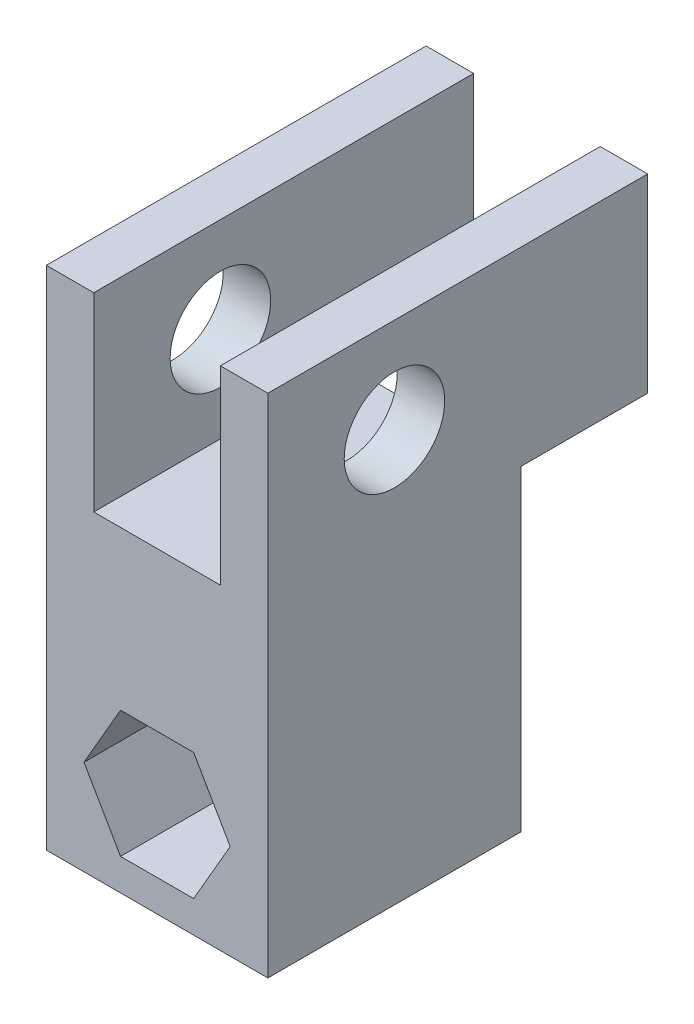
from build123d import *

# Parameters (mm, degrees)
BOSS_EXTRUDE1_DEPTH     = 25.4
CUT_EXTRUDE1_DEPTH      = 58.873030474
F_3_8_CLEARANCE_HOLE1_D = 10.0838
SKETCH7_W               = 4.7625
SKETCH7_H               = 19.05
BOSS_EXTRUDE2_DEPTH     = 12.7


with BuildPart() as part:
    # Sketch1 → Boss-Extrude1 (new body)
    with BuildSketch(Plane.XY):
        Polygon((-11.1125, 0), (11.1125, 0), (11.1125, 50.8), (6.35, 50.8), (6.35, 31.75), (-6.35, 31.75), (-6.35, 50.8), (-11.1125, 50.8), align=None)
    extrude(amount=BOSS_EXTRUDE1_DEPTH)

    # Sketch2 → Cut-Extrude1 (cut, through all)
    with BuildSketch(Plane.XY.offset(25.4)):
        Polygon((3.666174209, 15.875), (-3.666174209, 15.875), (-7.332348419, 9.525), (-3.666174209, 3.175), (3.666174209, 3.175), (7.332348419, 9.525), align=None)
    extrude(amount=-CUT_EXTRUDE1_DEPTH, mode=Mode.SUBTRACT)

    # 3/8 Clearance Hole1 (through all)
    with Locations(Plane.ZY.offset(11.1125)):
        with Locations((12.7, 41.275)):
            Hole(F_3_8_CLEARANCE_HOLE1_D / 2)

    # Sketch7 → Boss-Extrude2 (add)
    with BuildSketch(Plane(origin=(0, 0, 0), x_dir=(-1, 0, 0), z_dir=(0, 0, -1))):
        with Locations((-8.73125, 41.275)):
            Rectangle(SKETCH7_W, SKETCH7_H)
        with Locations((8.73125, 41.275)):
            Rectangle(SKETCH7_W, SKETCH7_H)
    extrude(amount=BOSS_EXTRUDE2_DEPTH)


solid = part.part
